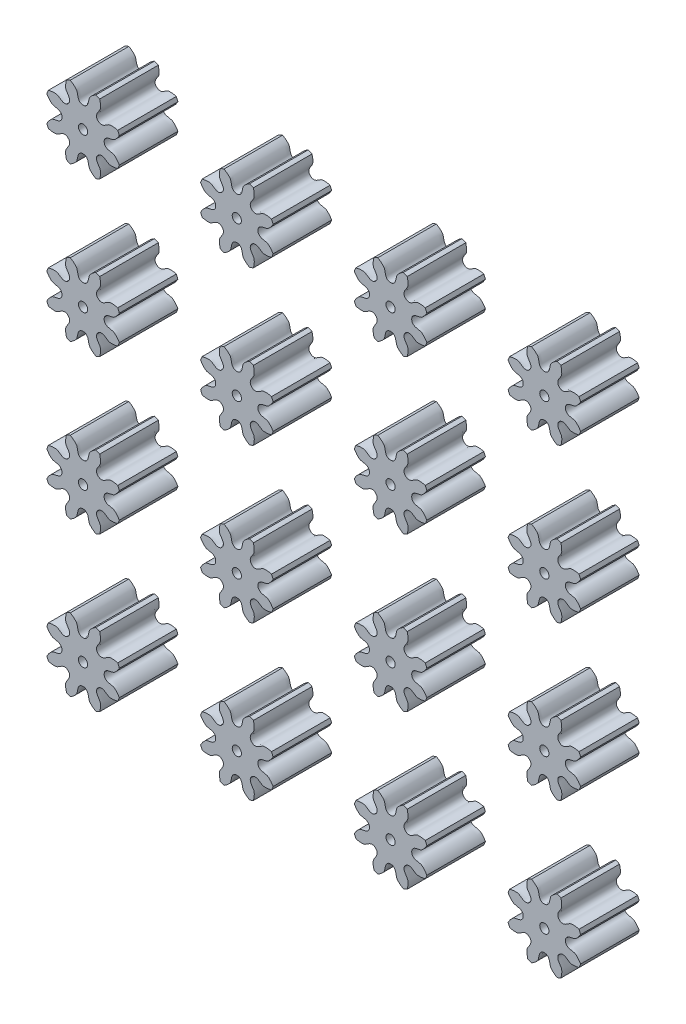
from build123d import *

# Parameters (mm, degrees)
SKETCHREVOLVESPURGEAR1_W       = 19.05
SKETCHREVOLVESPURGEAR1_H       = 12.499999812
TOOTHEXTRUDECUTSPURGEAR1_DEPTH = 9.525
PATTERNSPURGEAR1_COUNT         = 8
BOREREVOLVESKETCH_W            = 19.05
BOREREVOLVESKETCH_H            = 1.5
SCALE_1_SCALE                  = 0.2
PATTERN_LINEAR_1_COUNT         = 4
PATTERN_LINEAR_1_PITCH         = 10
PATTERN_LINEAR_1_2_COUNT       = 4
PATTERN_LINEAR_1_2_PITCH       = 10


with BuildPart() as part:
    # SketchRevolveSpurGear1 → SpurGear1 (revolve)
    with BuildSketch(Plane(origin=(0, 0, 0), x_dir=(0, 0, -1), z_dir=(1, 0, 0))):
        with Locations((0, 6.249999906)):
            Rectangle(SKETCHREVOLVESPURGEAR1_W, SKETCHREVOLVESPURGEAR1_H)
    revolve(axis=Axis((0, 0, 0), (0, 0, -1)))

    # SketchToothSpurGear1 → ToothExtrudeCutSpurGear1 (cut, symmetric)
    with BuildSketch(Plane.XY):
        with BuildLine():
            ThreePointArc((11.870789143, 4.298253754), (12.62499981, 0), (11.870789143, -4.298253754))
            add(Edge.make_bspline(
                [(11.870789143, -4.298253754), (11.705373466, -3.989903778), (11.466131585, -3.602884898), (11.132929162, -3.163175269), (10.945561236, -2.93760931), (10.76094687, -2.734796713), (10.580972796, -2.553396581), (10.40633248, -2.3946055), (9.752715321, -1.824613648), (8.869483929, -1.8283735), (8.172499607, -1.629803137), (8.151851011, -1.623719337), (8.131286356, -1.617473449), (8.110804149, -1.611059626), (8.090405079, -1.604478042), (8.070089275, -1.597727197), (8.049857042, -1.590805972), (8.029708669, -1.583713076), (8.009644479, -1.576447198), (7.989664822, -1.569006961), (7.969770079, -1.561390932), (7.949960662, -1.553597623), (7.930237023, -1.545625483), (7.910599648, -1.537472904), (7.891049069, -1.529138218), (7.87158586, -1.520619694), (7.852210645, -1.511915538), (7.8329241, -1.503023896), (7.813726957, -1.493942849), (7.794620007, -1.484670416), (7.775604106, -1.475204551), (7.756680177, -1.465543144), (7.737849217, -1.455684024), (7.719112299, -1.445624953), (7.700470581, -1.435363633), (7.681925307, -1.424897702), (7.663477813, -1.414224739), (7.645129535, -1.403342262), (7.626882012, -1.392247729), (7.608736896, -1.380938544), (7.590695953, -1.369412055), (7.572761072, -1.35766556), (7.554934272, -1.345696307), (7.537217709, -1.333501499), (7.51961368, -1.321078297), (7.502124634, -1.308423826), (7.484753176, -1.295535178), (7.467502077, -1.282409418), (7.450374279, -1.269043591), (7.433372903, -1.255434728), (7.416501258, -1.241579853), (7.399762848, -1.227475992), (7.383161377, -1.213120182), (7.366700759, -1.198509477), (7.350385125, -1.183640964), (7.334218828, -1.168511771), (7.318206453, -1.15311908), (7.30235282, -1.137460137), (7.286662991, -1.12153227), (7.271142276, -1.105332904), (7.25579624, -1.088859571), (7.240630702, -1.072109933), (7.225651744, -1.055081797), (7.21086571, -1.037773131), (7.196279208, -1.020182088), (7.181899115, -1.002307022), (7.16773257, -0.984146511), (7.153786976, -0.96569938), (7.140069997, -0.946964719), (7.126589551, -0.92794191), (7.113353806, -0.908630648), (7.100371171, -0.889030966), (7.087650286, -0.869143259), (7.075200008, -0.848968307), (7.063029401, -0.828507299), (7.051147719, -0.807761858), (7.039564386, -0.786734061), (7.028288975, -0.765426468), (7.01733119, -0.743842135), (7.006700835, -0.72198464), (6.996407793, -0.699858102), (6.986461992, -0.677467196), (6.976873374, -0.654817168), (6.967651866, -0.631913852), (6.958807339, -0.608763676), (6.950349575, -0.585373675), (6.942288226, -0.561751491), (6.934632776, -0.537905379), (6.927392498, -0.513844203), (6.920576414, -0.489577434), (6.914193253, -0.465115137), (6.908251408, -0.440467961), (6.902758894, -0.415647124), (6.897723306, -0.390664389), (6.893151782, -0.365532044), (6.889050959, -0.340262866), (6.88542694, -0.3148701), (6.882285263, -0.289367414), (6.879630838, -0.263768863), (6.877468041, -0.238088846), (6.875800231, -0.212342069), (6.874631425, -0.186543457), (6.873959938, -0.160708261), (6.873817609, -0.137396468), (6.874301667, -0.083826382), (6.87560374, 0), (6.874301667, 0.083826382), (6.873817609, 0.137396468), (6.873959938, 0.160708261), (6.874631425, 0.186543457), (6.875800231, 0.212342069), (6.877468041, 0.238088846), (6.879630838, 0.263768863), (6.882285263, 0.289367414), (6.88542694, 0.3148701), (6.889050959, 0.340262866), (6.893151782, 0.365532044), (6.897723306, 0.390664389), (6.902758894, 0.415647124), (6.908251408, 0.440467961), (6.914193253, 0.465115137), (6.920576414, 0.489577434), (6.927392498, 0.513844203), (6.934632776, 0.537905379), (6.942288226, 0.561751491), (6.950349575, 0.585373675), (6.958807339, 0.608763676), (6.967651866, 0.631913852), (6.976873374, 0.654817168), (6.986461992, 0.677467196), (6.996407793, 0.699858102), (7.006700835, 0.72198464), (7.01733119, 0.743842135), (7.028288975, 0.765426468), (7.039564386, 0.786734061), (7.051147719, 0.807761858), (7.063029401, 0.828507299), (7.075200008, 0.848968307), (7.087650286, 0.869143259), (7.100371171, 0.889030966), (7.113353806, 0.908630648), (7.126589551, 0.92794191), (7.140069997, 0.946964719), (7.153786976, 0.96569938), (7.16773257, 0.984146511), (7.181899115, 1.002307022), (7.196279208, 1.020182088), (7.21086571, 1.037773131), (7.225651744, 1.055081797), (7.240630702, 1.072109933), (7.25579624, 1.088859571), (7.271142276, 1.105332904), (7.286662991, 1.12153227), (7.30235282, 1.137460137), (7.318206453, 1.15311908), (7.334218828, 1.168511771), (7.350385125, 1.183640964), (7.366700759, 1.198509477), (7.383161377, 1.213120182), (7.399762848, 1.227475992), (7.416501258, 1.241579853), (7.433372903, 1.255434728), (7.450374279, 1.269043591), (7.467502077, 1.282409418), (7.484753176, 1.295535178), (7.502124634, 1.308423826), (7.51961368, 1.321078297), (7.537217709, 1.333501499), (7.554934272, 1.345696307), (7.572761072, 1.35766556), (7.590695953, 1.369412055), (7.608736896, 1.380938544), (7.626882012, 1.392247729), (7.645129535, 1.403342262), (7.663477813, 1.414224739), (7.681925307, 1.424897702), (7.700470581, 1.435363633), (7.719112299, 1.445624953), (7.737849217, 1.455684024), (7.756680177, 1.465543144), (7.775604106, 1.475204551), (7.794620007, 1.484670416), (7.813726957, 1.493942849), (7.8329241, 1.503023896), (7.852210645, 1.511915538), (7.87158586, 1.520619694), (7.891049069, 1.529138218), (7.910599648, 1.537472904), (7.930237023, 1.545625483), (7.949960662, 1.553597623), (7.969770079, 1.561390932), (7.989664822, 1.569006961), (8.009644479, 1.576447198), (8.029708669, 1.583713076), (8.049857042, 1.590805972), (8.070089275, 1.597727197), (8.090405079, 1.604478042), (8.110804149, 1.611059626), (8.131286356, 1.617473449), (8.151851011, 1.623719337), (8.172499607, 1.629803137), (8.869483929, 1.8283735), (9.752715321, 1.824613648), (10.40633248, 2.3946055), (10.580972796, 2.553396581), (10.76094687, 2.734796713), (10.945561236, 2.93760931), (11.132929162, 3.163175269), (11.466131585, 3.602884898), (11.705373466, 3.989903778), (11.870789143, 4.298253754)],
                knots=[0, 0, 0, 0, 0.074362536, 0.096474121, 0.11724561, 0.136677004, 0.154768301, 0.171519502, 0.186930608, 0.337992419, 0.339519997, 0.341045219, 0.3425682, 0.34408906, 0.345607918, 0.347124896, 0.34864012, 0.350153717, 0.351665818, 0.353176553, 0.354686058, 0.356194471, 0.35770193, 0.359208579, 0.360714562, 0.362220025, 0.36372512, 0.365229998, 0.366734814, 0.368239725, 0.369744891, 0.371250474, 0.372756638, 0.37426355, 0.375771379, 0.377280296, 0.378790475, 0.380302091, 0.38181532, 0.383330343, 0.38484734, 0.386366493, 0.387887986, 0.389412003, 0.390938732, 0.392468359, 0.394001071, 0.395537057, 0.397076505, 0.398619602, 0.400166537, 0.401717496, 0.403272666, 0.40483223, 0.406396372, 0.407965272, 0.409539107, 0.411118054, 0.412702283, 0.414291961, 0.415887251, 0.417488311, 0.419095292, 0.420708339, 0.422327593, 0.423953183, 0.425585234, 0.427223858, 0.428869161, 0.430521238, 0.432180171, 0.433846034, 0.435518885, 0.437198773, 0.438885731, 0.440579778, 0.442280919, 0.443989142, 0.445704421, 0.447426712, 0.449155956, 0.450892074, 0.45263497, 0.454384532, 0.456140627, 0.457903105, 0.459671798, 0.461446518, 0.46322706, 0.4650132, 0.466804697, 0.468601293, 0.470402712, 0.472208662, 0.474018836, 0.475832913, 0.477650558, 0.479471424, 0.48129515, 0.483121367, 0.484949698, 0.486779757, 0.488611151, 0.490443484, 0.491735334, 0.5, 0.508264666, 0.509556516, 0.511388849, 0.513220243, 0.515050302, 0.516878633, 0.51870485, 0.520528576, 0.522349442, 0.524167087, 0.525981164, 0.527791338, 0.529597288, 0.531398707, 0.533195303, 0.5349868, 0.53677294, 0.538553482, 0.540328202, 0.542096895, 0.543859373, 0.545615468, 0.54736503, 0.549107926, 0.550844044, 0.552573288, 0.554295579, 0.556010858, 0.557719081, 0.559420222, 0.561114269, 0.562801227, 0.564481115, 0.566153966, 0.567819829, 0.569478762, 0.571130839, 0.572776142, 0.574414766, 0.576046817, 0.577672407, 0.579291661, 0.580904708, 0.582511689, 0.584112749, 0.585708039, 0.587297717, 0.588881946, 0.590460893, 0.592034728, 0.593603628, 0.59516777, 0.596727334, 0.598282504, 0.599833463, 0.601380398, 0.602923495, 0.604462943, 0.605998929, 0.607531641, 0.609061268, 0.610587997, 0.612112014, 0.613633507, 0.61515266, 0.616669657, 0.61818468, 0.619697909, 0.621209525, 0.622719704, 0.624228621, 0.62573645, 0.627243362, 0.628749526, 0.630255109, 0.631760275, 0.633265186, 0.634770002, 0.63627488, 0.637779975, 0.639285438, 0.640791421, 0.64229807, 0.643805529, 0.645313942, 0.646823447, 0.648334182, 0.649846283, 0.65135988, 0.652875104, 0.654392082, 0.65591094, 0.6574318, 0.658954781, 0.660480003, 0.662007581, 0.813069392, 0.828480498, 0.845231699, 0.863322996, 0.88275439, 0.903525879, 0.925637464, 1, 1, 1, 1], degree=3))
        make_face()
    toothextrudecutspurgear1 = extrude(amount=TOOTHEXTRUDECUTSPURGEAR1_DEPTH, both=True, mode=Mode.SUBTRACT)

    # PatternSpurGear1: ToothExtrudeCutSpurGear1 ×8 about axis
    patternspurgear1_axis = Axis((0, 0, 55), (0, 0, -1))
    for i in range(1, PATTERNSPURGEAR1_COUNT):
        add(toothextrudecutspurgear1.rotate(patternspurgear1_axis, i * 360 / PATTERNSPURGEAR1_COUNT), mode=Mode.SUBTRACT)

    # BoreRevolveSketch → BoreRevolveCut (revolve, cut)
    with BuildSketch(Plane(origin=(0, 0, 0), x_dir=(0, 0, -1), z_dir=(1, 0, 0))):
        with Locations((0, 0.75)):
            Rectangle(BOREREVOLVESKETCH_W, BOREREVOLVESKETCH_H)
    revolve(axis=Axis((0, 0, 0), (0, 0, -1)), mode=Mode.SUBTRACT)


with BuildPart() as part_1:
    # 缩放比例1: scaled about (0, 0, 0)
    add(part.part.scale(SCALE_1_SCALE))


with BuildPart() as pattern_linear_1_1:
    # 阵列(线性)1: pattern copy
    add(part_1.part.moved(Location(Vector(1, 0, 0) * (1 * PATTERN_LINEAR_1_PITCH))))


with BuildPart() as pattern_linear_1_2:
    # 阵列(线性)1: pattern copy
    add(part_1.part.moved(Location(Vector(1, 0, 0) * (2 * PATTERN_LINEAR_1_PITCH))))


with BuildPart() as pattern_linear_1_3:
    # 阵列(线性)1: pattern copy
    add(part_1.part.moved(Location(Vector(1, 0, 0) * (3 * PATTERN_LINEAR_1_PITCH))))


with BuildPart() as pattern_linear_1_2_1:
    # Pattern Linear 1 2: pattern copy
    add(part_1.part.moved(Location(Vector(0, 1, 0) * (1 * PATTERN_LINEAR_1_2_PITCH))))


with BuildPart() as pattern_linear_1_2_2:
    # Pattern Linear 1 2: pattern copy
    add(part_1.part.moved(Location(Vector(0, 1, 0) * (2 * PATTERN_LINEAR_1_2_PITCH))))


with BuildPart() as pattern_linear_1_2_3:
    # Pattern Linear 1 2: pattern copy
    add(part_1.part.moved(Location(Vector(0, 1, 0) * (3 * PATTERN_LINEAR_1_2_PITCH))))


with BuildPart() as pattern_linear_1_2_4:
    # Pattern Linear 1 2: pattern copy
    add(pattern_linear_1_1.part.moved(Location(Vector(0, 1, 0) * (1 * PATTERN_LINEAR_1_2_PITCH))))


with BuildPart() as pattern_linear_1_2_5:
    # Pattern Linear 1 2: pattern copy
    add(pattern_linear_1_1.part.moved(Location(Vector(0, 1, 0) * (2 * PATTERN_LINEAR_1_2_PITCH))))


with BuildPart() as pattern_linear_1_2_6:
    # Pattern Linear 1 2: pattern copy
    add(pattern_linear_1_1.part.moved(Location(Vector(0, 1, 0) * (3 * PATTERN_LINEAR_1_2_PITCH))))


with BuildPart() as pattern_linear_1_2_7:
    # Pattern Linear 1 2: pattern copy
    add(pattern_linear_1_2.part.moved(Location(Vector(0, 1, 0) * (1 * PATTERN_LINEAR_1_2_PITCH))))


with BuildPart() as pattern_linear_1_2_8:
    # Pattern Linear 1 2: pattern copy
    add(pattern_linear_1_2.part.moved(Location(Vector(0, 1, 0) * (2 * PATTERN_LINEAR_1_2_PITCH))))


with BuildPart() as pattern_linear_1_2_9:
    # Pattern Linear 1 2: pattern copy
    add(pattern_linear_1_2.part.moved(Location(Vector(0, 1, 0) * (3 * PATTERN_LINEAR_1_2_PITCH))))


with BuildPart() as pattern_linear_1_2_10:
    # Pattern Linear 1 2: pattern copy
    add(pattern_linear_1_3.part.moved(Location(Vector(0, 1, 0) * (1 * PATTERN_LINEAR_1_2_PITCH))))


with BuildPart() as pattern_linear_1_2_11:
    # Pattern Linear 1 2: pattern copy
    add(pattern_linear_1_3.part.moved(Location(Vector(0, 1, 0) * (2 * PATTERN_LINEAR_1_2_PITCH))))


with BuildPart() as pattern_linear_1_2_12:
    # Pattern Linear 1 2: pattern copy
    add(pattern_linear_1_3.part.moved(Location(Vector(0, 1, 0) * (3 * PATTERN_LINEAR_1_2_PITCH))))


solid = Compound([part_1.part, pattern_linear_1_1.part, pattern_linear_1_2.part, pattern_linear_1_3.part, pattern_linear_1_2_1.part, pattern_linear_1_2_2.part, pattern_linear_1_2_3.part, pattern_linear_1_2_4.part, pattern_linear_1_2_5.part, pattern_linear_1_2_6.part, pattern_linear_1_2_7.part, pattern_linear_1_2_8.part, pattern_linear_1_2_9.part, pattern_linear_1_2_10.part, pattern_linear_1_2_11.part, pattern_linear_1_2_12.part])
